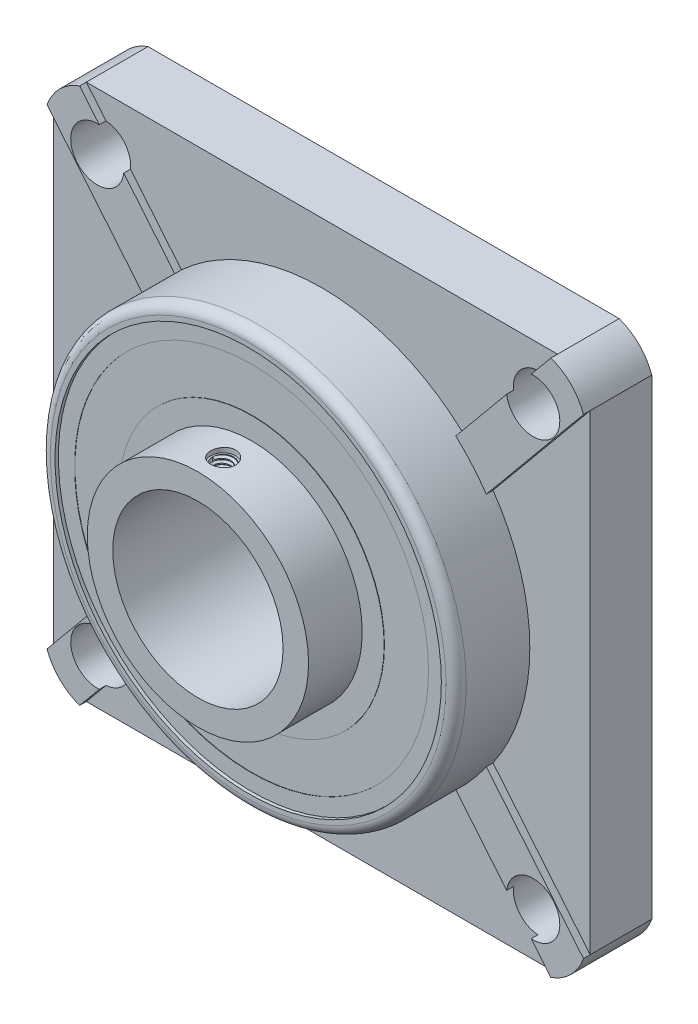
from build123d import *
from build123d.topology import SkipClean

# Parameters (mm, degrees)
CROQUIS1_W              = 160
CROQUIS1_H              = 160
CROQUIS1_R              = 25.4
SALIENTE_EXTRUIR1_DEPTH = 55.372
CROQUIS2_R              = 7.9375
CORTAR_EXTRUIR1_DEPTH   = 55.372
CROQUIS3_W              = 190.71440792
CROQUIS3_H              = 189.407689112
CROQUIS3_R              = 33
CORTAR_EXTRUIR2_DEPTH   = 15
CROQUIS4_W              = 202.365864706
CROQUIS4_H              = 205.804976222
CROQUIS4_R              = 62
CORTAR_EXTRUIR3_DEPTH   = 20
CORTAR_EXTRUIR4_DEPTH   = 60
CORTAR_EXTRUIR5_DEPTH   = 2
REDONDEO1_R             = 3
CROQUIS7_R              = 57.609199973
CROQUIS7_R_2            = 33
CORTAR_EXTRUIR6_DEPTH   = 1
CROQUIS8_R              = 52.775803174
CROQUIS8_R_2            = 39.543677301
CORTAR_EXTRUIR7_DEPTH   = 0.1
CROQUIS9_R              = 3.175
CORTAR_EXTRUIR8_DEPTH   = 65
CROQUIS10_R             = 3.704011253
CORTAR_EXTRUIR9_DEPTH   = 48.5
ROSCA1_PITCH            = 1.27


with BuildPart() as part:
    # Croquis1 → Saliente-Extruir1 (new body)
    with BuildSketch(Plane.XY):
        Rectangle(CROQUIS1_W, CROQUIS1_H)
        Circle(CROQUIS1_R, mode=Mode.SUBTRACT)
    extrude(amount=SALIENTE_EXTRUIR1_DEPTH)

    # Croquis2 → Cortar-Extruir1 (cut)
    with BuildSketch(Plane.XY.offset(55.372)):
        with Locations((65, 65)):
            Circle(CROQUIS2_R)
        with Locations(Location((-65, 65, 0), (0, 0, 180))):
            Circle(CROQUIS2_R)
        with Locations((-65, -65)):
            Circle(CROQUIS2_R)
        with Locations(Location((65, -65, 0), (0, 0, 180))):
            Circle(CROQUIS2_R)
    extrude(amount=-CORTAR_EXTRUIR1_DEPTH, mode=Mode.SUBTRACT)

    # Croquis3 → Cortar-Extruir2 (cut)
    with BuildSketch(Plane.XY.offset(55.372)):
        Rectangle(CROQUIS3_W, CROQUIS3_H)
        Circle(CROQUIS3_R, mode=Mode.SUBTRACT)
    extrude(amount=-CORTAR_EXTRUIR2_DEPTH, mode=Mode.SUBTRACT)

    # Croquis4 → Cortar-Extruir3 (cut)
    with BuildSketch(Plane.XY.offset(40.372)):
        Rectangle(CROQUIS4_W, CROQUIS4_H)
        Circle(CROQUIS4_R, mode=Mode.SUBTRACT)
    extrude(amount=-CORTAR_EXTRUIR3_DEPTH, mode=Mode.SUBTRACT)

    # Croquis5 → Cortar-Extruir4 (cut)
    with BuildSketch(Plane.XY.offset(20.372)):
        with BuildLine():
            Line((-65, 80.899), (-65, 94.239394185))
            Line((-65, 94.239394185), (-100.175900806, 94.239394185))
            Line((-100.175900806, 94.239394185), (-100.175900806, 65))
            Line((-100.175900806, 65), (-80.899, 65))
            ThreePointArc((-80.899, 65), (-76.242290714, 76.242290714), (-65, 80.899))
        make_face()
        with BuildLine():
            Line((-100.175900806, -94.239394185), (-65, -94.239394185))
            Line((-65, -94.239394185), (-65, -80.899))
            ThreePointArc((-65, -80.899), (-76.242290714, -76.242290714), (-80.899, -65))
            Line((-80.899, -65), (-100.175900806, -65))
            Line((-100.175900806, -65), (-100.175900806, -94.239394185))
        make_face()
        with BuildLine():
            Line((100.175900806, -94.239394185), (100.175900806, -65))
            Line((100.175900806, -65), (80.899, -65))
            ThreePointArc((80.899, -65), (76.242290714, -76.242290714), (65, -80.899))
            Line((65, -80.899), (65, -94.239394185))
            Line((65, -94.239394185), (100.175900806, -94.239394185))
        make_face()
        with BuildLine():
            Line((65, 80.899), (65, 94.239394185))
            Line((65, 94.239394185), (100.175900806, 94.239394185))
            Line((100.175900806, 94.239394185), (100.175900806, 65))
            Line((100.175900806, 65), (80.899, 65))
            ThreePointArc((80.899, 65), (76.242290714, 76.242290714), (65, 80.899))
        make_face()
    extrude(amount=-CORTAR_EXTRUIR4_DEPTH, mode=Mode.SUBTRACT)

    # Croquis6 → Cortar-Extruir5 (cut)
    with SkipClean():  # the faces are left unmerged after this step: merging them gives an invalid solid
        with BuildSketch(Plane.XY.offset(20.372)):
            with BuildLine():
                Line((-70.270502917, 80), (-41.913035927, 45.686950209))
                ThreePointArc((-41.913035927, 45.686950209), (0, 62), (41.913035927, 45.686950209))
                Line((41.913035927, 45.686950209), (70.270502917, 80))
                Line((70.270502917, 80), (70.270502917, 86.838178764))
                Line((70.270502917, 86.838178764), (-70.270502917, 86.838178764))
                Line((-70.270502917, 86.838178764), (-70.270502917, 80))
            make_face()
            with BuildLine():
                Line((-80, 70.270502917), (-51.028680753, 35.214680753))
                ThreePointArc((-51.028680753, 35.214680753), (-62, 0), (-51.028680753, -35.214680753))
                Line((-51.028680753, -35.214680753), (-80, -70.270502917))
                Line((-80, -70.270502917), (-87.446563718, -70.270502917))
                Line((-87.446563718, -70.270502917), (-87.446563718, 70.270502917))
                Line((-87.446563718, 70.270502917), (-80, 70.270502917))
            make_face()
            with BuildLine():
                Line((80, 70.270502917), (51.028680753, 35.214680753))
                ThreePointArc((51.028680753, 35.214680753), (62, 0), (51.028680753, -35.214680753))
                Line((51.028680753, -35.214680753), (80, -70.270502917))
                Line((80, -70.270502917), (87.446563718, -70.270502917))
                Line((87.446563718, -70.270502917), (87.446563718, 70.270502917))
                Line((87.446563718, 70.270502917), (80, 70.270502917))
            make_face()
            with BuildLine():
                Line((70.270502917, -86.838178764), (-70.270502917, -86.838178764))
                Line((-70.270502917, -86.838178764), (-70.270502917, -80))
                Line((-70.270502917, -80), (-41.913035927, -45.686950209))
                ThreePointArc((-41.913035927, -45.686950209), (0, -62), (41.913035927, -45.686950209))
                Line((41.913035927, -45.686950209), (70.270502917, -80))
                Line((70.270502917, -80), (70.270502917, -86.838178764))
            make_face()
        extrude(amount=-CORTAR_EXTRUIR5_DEPTH, mode=Mode.SUBTRACT)

    # Redondeo1
    redondeo1_edges = [part.edges().sort_by_distance(p)[0] for p in [
        (-62, 0, 40.372),
    ]]
    fillet(redondeo1_edges, radius=REDONDEO1_R)

    # Croquis7 → Cortar-Extruir6 (cut)
    with BuildSketch(Plane.XY.offset(40.372)):
        Circle(CROQUIS7_R)
        Circle(CROQUIS7_R_2, mode=Mode.SUBTRACT)
    extrude(amount=-CORTAR_EXTRUIR6_DEPTH, mode=Mode.SUBTRACT)

    # Croquis8 → Cortar-Extruir7 (cut)
    with BuildSketch(Plane.XY.offset(39.372)):
        Circle(CROQUIS8_R)
        Circle(CROQUIS8_R_2, mode=Mode.SUBTRACT)
    extrude(amount=-CORTAR_EXTRUIR7_DEPTH, mode=Mode.SUBTRACT)

    # Croquis9 → Cortar-Extruir8 (cut)
    with BuildSketch(Plane(origin=(0, 80, 0), x_dir=(1, 0, 0), z_dir=(0, 1, 0))):
        with Locations(Location((0, -47.851689374, 0), (0, 0, 270))):
            Circle(CROQUIS9_R)
    extrude(amount=-CORTAR_EXTRUIR8_DEPTH, mode=Mode.SUBTRACT)

    # Croquis10 → Cortar-Extruir9 (cut)
    with BuildSketch(Plane(origin=(0, 80, 0), x_dir=(1, 0, 0), z_dir=(0, 1, 0))):
        with Locations(Location((0, -47.851689374, 0), (0, 0, 270))):
            Circle(CROQUIS10_R)
    extrude(amount=-CORTAR_EXTRUIR9_DEPTH, mode=Mode.SUBTRACT)

    # Rosca1: the profile of Perfil de rosca1 profile screwed along a right-hand helix of 4.724409 turns, 8 arcs to a turn; built about Z, then put on its axis
    with SkipClean():  # the faces are left unmerged after this step: merging them gives an invalid solid
        rosca1_z = Axis((0, 0, 0), (0, 0, 1))
        rosca1_corners = [(3.1756, 0, -0.00034641), (3.1756, 0, 1.111596407), (2.487592339, 0, 0.714374998), (2.487592339, 0, 0.396874998)]
        with BuildLine(mode=Mode.PRIVATE) as rosca1_profile:
            Line(rosca1_corners[0], rosca1_corners[1])
            Line(rosca1_corners[1], rosca1_corners[2])
            Line(rosca1_corners[2], rosca1_corners[3])
            Line(rosca1_corners[3], rosca1_corners[0])
        rosca1_cap = Face(rosca1_profile.wire())
        rosca1_turn_angles = [0, 22.5, 45, 67.5, 90, 112.5, 135, 157.5, 180, 202.5, 225, 247.5, 270, 292.5, 315, 337.5, 360]
        rosca1_turn_weights = [1, 0.9238795325112867, 1, 0.9238795325112867, 1, 0.9238795325112867, 1, 0.9238795325112867, 1, 0.9238795325112867, 1, 0.9238795325112867, 1, 0.9238795325112867, 1, 0.9238795325112867, 1]
        rosca1_turn_rails = [Edge.make_bspline([Vector(p[0], p[1], 0).rotate(rosca1_z, rosca1_turn_angles[k]) / rosca1_turn_weights[k] + Vector(0, 0, p[2] + ROSCA1_PITCH * rosca1_turn_angles[k] / 360) for k in range(17)], [0, 0, 0, 1, 1, 2, 2, 3, 3, 4, 4, 5, 5, 6, 6, 7, 7, 8, 8, 8], 2, rosca1_turn_weights) for p in rosca1_corners]
        rosca1_turn_sides = [Face.make_surface_from_curves(rosca1_turn_rails[p[0]], rosca1_turn_rails[p[1]]) for p in [(0, 1), (1, 2), (2, 3), (3, 0)]]
        rosca1_last_angles = [1440, 1462.5, 1485, 1507.5, 1530, 1552.5, 1575, 1597.5, 1620, 1642.5, 1665, 1682.893700787, 1700.787401575]
        rosca1_last_weights = [1, 0.9238795325112867, 1, 0.9238795325112867, 1, 0.9238795325112867, 1, 0.9238795325112867, 1, 0.9238795325112867, 1, 0.9516281895296061, 1]
        rosca1_last_rails = [Edge.make_bspline([Vector(p[0], p[1], 0).rotate(rosca1_z, rosca1_last_angles[k]) / rosca1_last_weights[k] + Vector(0, 0, p[2] + ROSCA1_PITCH * rosca1_last_angles[k] / 360) for k in range(13)], [0, 0, 0, 1, 1, 2, 2, 3, 3, 4, 4, 5, 5, 6, 6, 6], 2, rosca1_last_weights) for p in rosca1_corners]
        rosca1_last_sides = [Face.make_surface_from_curves(rosca1_last_rails[p[0]], rosca1_last_rails[p[1]]) for p in [(0, 1), (1, 2), (2, 3), (3, 0)]]
        rosca1 = Plane(origin=(0, 31.5, 47.851689374), x_dir=(-1, 0, 0), z_dir=(0, -1, 0)) * Solid(Shell([*[p.moved(Location((0, 0, ROSCA1_PITCH * i))) for i in range(4) for p in rosca1_turn_sides], *rosca1_last_sides, rosca1_cap, rosca1_cap.rotate(rosca1_z, 1700.787401575).moved(Location((0, 0, ROSCA1_PITCH * 1700.787401575 / 360)))]))
        add(rosca1)


solid = part.part
